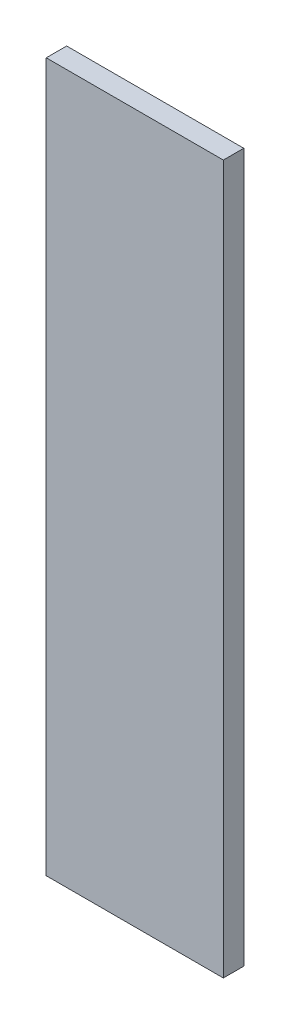
from build123d import *

# Parameters (mm, degrees)
SKETCH1_W           = 165.1
SKETCH1_H           = 660.4
BOSS_EXTRUDE1_DEPTH = 19.05


with BuildPart() as part:
    # Sketch1 → Boss-Extrude1 (new body)
    with BuildSketch(Plane.XY):
        with Locations((33.292567916, -240.259577714)):
            Rectangle(SKETCH1_W, SKETCH1_H)
    extrude(amount=BOSS_EXTRUDE1_DEPTH)


solid = part.part
